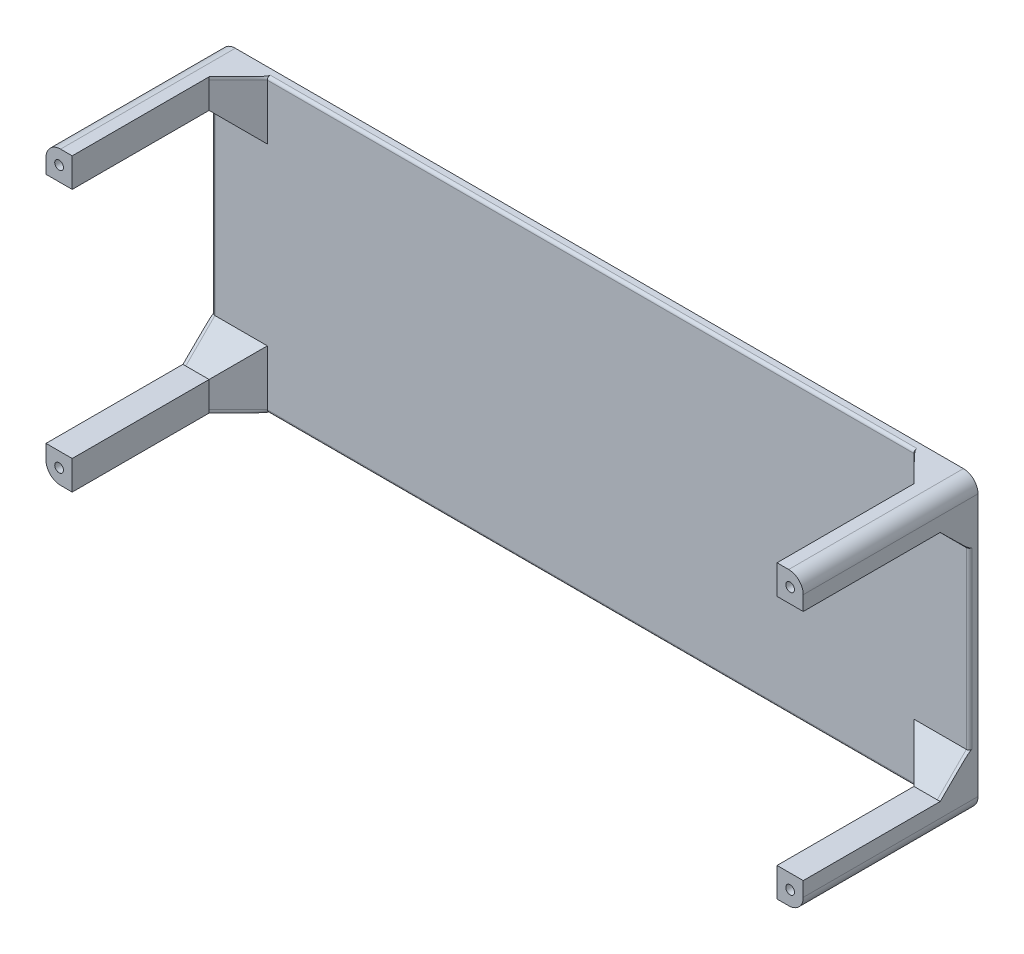
from build123d import *

# Parameters (mm, degrees)
SKETCH_1_W          = 260
SKETCH_1_H          = 100
EXTRUDE_1_DEPTH     = 3
SKETCH_2_W          = 9
SKETCH_2_H          = 10
EXTRUDE_2_DEPTH     = 60
FILLET_3_R          = 5
FILLET_4_R          = 1
SKETCH_3_R          = 1.5
CUT_EXTRUDE_1_DEPTH = 10
CHAMFER_1_SIZE      = 10


with BuildPart() as part:
    # 草图1 → 凸台-拉伸1 (new body)
    with BuildSketch(Plane.XY):
        Rectangle(SKETCH_1_W, SKETCH_1_H)
    extrude(amount=EXTRUDE_1_DEPTH)

    # 草图2 → 凸台-拉伸2 (add)
    with BuildSketch(Plane(origin=(0, 0, 0), x_dir=(-1, 0, 0), z_dir=(0, 0, -1))):
        with Locations((125.5, 45)):
            Rectangle(SKETCH_2_W, SKETCH_2_H)
        with Locations((125.5, -45)):
            Rectangle(SKETCH_2_W, SKETCH_2_H)
        with Locations((-125.5, -45)):
            Rectangle(SKETCH_2_W, SKETCH_2_H)
        with Locations((-125.5, 45)):
            Rectangle(SKETCH_2_W, SKETCH_2_H)
    extrude(amount=-EXTRUDE_2_DEPTH)

    # 圆角3
    fillet_3_edges = [part.edges().sort_by_distance(p)[0] for p in [
        (130, -50, 30),
        (-130, -50, 30),
        (-130, 50, 30),
        (130, 50, 30),
    ]]
    fillet(fillet_3_edges, radius=FILLET_3_R)

    # 圆角4
    fillet_4_edges = [part.edges().sort_by_distance(p)[0] for p in [
        (0, -50, 3),
        (-130, 0, 3),
        (130, 0, 3),
        (0, 50, 3),
    ]]
    fillet(fillet_4_edges, radius=FILLET_4_R)

    # 草图3 → 切除-拉伸1 (cut)
    with BuildSketch(Plane.XY.offset(60)):
        with Locations((125.5, -45)):
            Circle(SKETCH_3_R)
        with Locations((125.5, 45)):
            Circle(SKETCH_3_R)
        with Locations((-125.5, -45)):
            Circle(SKETCH_3_R)
        with Locations((-125.5, 45)):
            Circle(SKETCH_3_R)
    extrude(amount=-CUT_EXTRUDE_1_DEPTH, mode=Mode.SUBTRACT)

    # 倒角1
    # the kernel refuses this chamfer: 10 mm, written as the material it adds along each edge
    with BuildSketch(Plane(origin=(121, 40, 3), x_dir=(0, -1, 0), z_dir=(1, 0, 0))) as chamfer_1_piece_1:
        Polygon((CHAMFER_1_SIZE, 0), (0, -CHAMFER_1_SIZE), (0, 0), align=None)
    extrude(amount=8)
    with BuildSketch(Plane(origin=(-121, 49, 3), x_dir=(1, 0, 0), z_dir=(0, -1, 0))) as chamfer_1_piece_2:
        Polygon((CHAMFER_1_SIZE, 0), (0, CHAMFER_1_SIZE), (0, 0), align=None)
    extrude(amount=9)
    with BuildSketch(Plane(origin=(-129, -40, 3), x_dir=(0, 1, 0), z_dir=(1, 0, 0)), Plane(origin=(-121, 40, 3), x_dir=(0, -1, 0), z_dir=(-1, 0, 0)), Plane(origin=(121, -40, 3), x_dir=(0, 1, 0), z_dir=(1, 0, 0))) as chamfer_1_piece_3:
        Polygon((CHAMFER_1_SIZE, 0), (0, CHAMFER_1_SIZE), (0, 0), align=None)
    extrude(amount=8)
    with BuildSketch(Plane(origin=(121, -49, 3), x_dir=(0, 0, 1), z_dir=(0, 1, 0)), Plane(origin=(-121, -40, 3), x_dir=(0, 0, 1), z_dir=(0, -1, 0)), Plane(origin=(121, 49, 3), x_dir=(-1, 0, 0), z_dir=(0, -1, 0))) as chamfer_1_piece_4:
        Polygon((CHAMFER_1_SIZE, 0), (0, -CHAMFER_1_SIZE), (0, 0), align=None)
    extrude(amount=9)
    with BuildSketch(Plane(origin=(-121, 49, 2), x_dir=(0, 0, 1), z_dir=(0, -1, 0))) as chamfer_1_piece_5_section:
        Polygon((1 + CHAMFER_1_SIZE, 0), (1, -CHAMFER_1_SIZE), (1, 0), align=None)
    chamfer_1_piece_5 = revolve(axis=Axis((-121, 49, 2), (-1, 0, 0)), revolution_arc=359.64, mode=Mode.PRIVATE)
    chamfer_1_piece_5 = split(chamfer_1_piece_5, bisect_by=Plane(origin=(-121, 49, 0), z_dir=(0, 0, 1)), keep=Keep.TOP, mode=Mode.PRIVATE)
    chamfer_1_piece_5 = split(chamfer_1_piece_5, bisect_by=Plane(origin=(-121, 50, 2), z_dir=(0, -1, 0)), keep=Keep.TOP, mode=Mode.PRIVATE)
    add(chamfer_1_piece_5)
    with BuildSketch(Plane(origin=(121, 49, 2), x_dir=(0, 0, 1), z_dir=(0, -1, 0))) as chamfer_1_piece_6_section:
        Polygon((1, CHAMFER_1_SIZE), (1 + CHAMFER_1_SIZE, 0), (1, 0), align=None)
    chamfer_1_piece_6 = revolve(axis=Axis((121, 49, 2), (-1, 0, 0)), revolution_arc=359.64, mode=Mode.PRIVATE)
    chamfer_1_piece_6 = split(chamfer_1_piece_6, bisect_by=Plane(origin=(121, 49, 0), z_dir=(0, 0, 1)), keep=Keep.TOP, mode=Mode.PRIVATE)
    chamfer_1_piece_6 = split(chamfer_1_piece_6, bisect_by=Plane(origin=(121, 50, 2), z_dir=(0, -1, 0)), keep=Keep.TOP, mode=Mode.PRIVATE)
    add(chamfer_1_piece_6)
    with BuildSketch(Plane(origin=(-129, -40, 2), x_dir=(0, 0, 1), z_dir=(1, 0, 0))) as chamfer_1_piece_7_section:
        Polygon((1 + CHAMFER_1_SIZE, 0), (1, -CHAMFER_1_SIZE), (1, 0), align=None)
    chamfer_1_piece_7 = revolve(axis=Axis((-129, -40, 2), (0, -1, 0)), revolution_arc=359.64, mode=Mode.PRIVATE)
    chamfer_1_piece_7 = split(chamfer_1_piece_7, bisect_by=Plane(origin=(-129, -40, 0), z_dir=(0, 0, 1)), keep=Keep.TOP, mode=Mode.PRIVATE)
    chamfer_1_piece_7 = split(chamfer_1_piece_7, bisect_by=Plane(origin=(-130, -40, 2), z_dir=(1, 0, 0)), keep=Keep.TOP, mode=Mode.PRIVATE)
    add(chamfer_1_piece_7)
    with BuildSketch(Plane(origin=(-129, 40, 2), x_dir=(0, 0, 1), z_dir=(1, 0, 0))) as chamfer_1_piece_8_section:
        Polygon((1, CHAMFER_1_SIZE), (1 + CHAMFER_1_SIZE, 0), (1, 0), align=None)
    chamfer_1_piece_8 = revolve(axis=Axis((-129, 40, 2), (0, -1, 0)), revolution_arc=359.64, mode=Mode.PRIVATE)
    chamfer_1_piece_8 = split(chamfer_1_piece_8, bisect_by=Plane(origin=(-129, 40, 0), z_dir=(0, 0, 1)), keep=Keep.TOP, mode=Mode.PRIVATE)
    chamfer_1_piece_8 = split(chamfer_1_piece_8, bisect_by=Plane(origin=(-130, 40, 2), z_dir=(1, 0, 0)), keep=Keep.TOP, mode=Mode.PRIVATE)
    add(chamfer_1_piece_8)
    with BuildSketch(Plane(origin=(129, 40, 2), x_dir=(0, 0, 1), z_dir=(-1, 0, 0))) as chamfer_1_piece_9_section:
        Polygon((1, -CHAMFER_1_SIZE), (1 + CHAMFER_1_SIZE, 0), (1, 0), align=None)
    chamfer_1_piece_9 = revolve(axis=Axis((129, 40, 2), (0, 1, 0)), revolution_arc=359.64, mode=Mode.PRIVATE)
    chamfer_1_piece_9 = split(chamfer_1_piece_9, bisect_by=Plane(origin=(129, 40, 0), z_dir=(0, 0, 1)), keep=Keep.TOP, mode=Mode.PRIVATE)
    chamfer_1_piece_9 = split(chamfer_1_piece_9, bisect_by=Plane(origin=(130, 40, 2), z_dir=(-1, 0, 0)), keep=Keep.TOP, mode=Mode.PRIVATE)
    add(chamfer_1_piece_9)
    with BuildSketch(Plane(origin=(129, -40, 2), x_dir=(0, 0, 1), z_dir=(-1, 0, 0))) as chamfer_1_piece_10_section:
        Polygon((1 + CHAMFER_1_SIZE, 0), (1, CHAMFER_1_SIZE), (1, 0), align=None)
    chamfer_1_piece_10 = revolve(axis=Axis((129, -40, 2), (0, 1, 0)), revolution_arc=359.64, mode=Mode.PRIVATE)
    chamfer_1_piece_10 = split(chamfer_1_piece_10, bisect_by=Plane(origin=(129, -40, 0), z_dir=(0, 0, 1)), keep=Keep.TOP, mode=Mode.PRIVATE)
    chamfer_1_piece_10 = split(chamfer_1_piece_10, bisect_by=Plane(origin=(130, -40, 2), z_dir=(-1, 0, 0)), keep=Keep.TOP, mode=Mode.PRIVATE)
    add(chamfer_1_piece_10)
    with BuildSketch(Plane(origin=(121, -49, 2), x_dir=(0, 0.006283143965553963, 0.9999802608561372), z_dir=(0, -0.9999802608561372, 0.006283143965553963))) as chamfer_1_piece_11_section:
        Polygon((1, CHAMFER_1_SIZE), (1 + CHAMFER_1_SIZE, 0), (1, 0), align=None)
    chamfer_1_piece_11 = revolve(axis=Axis((121, -49, 2), (-1, 0, 0)), revolution_arc=359.64, mode=Mode.PRIVATE)
    chamfer_1_piece_11 = split(chamfer_1_piece_11, bisect_by=Plane(origin=(121, -50, 2), z_dir=(0, 1, 0)), keep=Keep.TOP, mode=Mode.PRIVATE)
    chamfer_1_piece_11 = split(chamfer_1_piece_11, bisect_by=Plane(origin=(121, -49, 0), z_dir=(0, 0, 1)), keep=Keep.TOP, mode=Mode.PRIVATE)
    add(chamfer_1_piece_11)
    with BuildSketch(Plane(origin=(-121, -49, 2), x_dir=(0, 0.006283143965553963, 0.9999802608561372), z_dir=(0, -0.9999802608561372, 0.006283143965553963))) as chamfer_1_piece_12_section:
        Polygon((1 + CHAMFER_1_SIZE, 0), (1, -CHAMFER_1_SIZE), (1, 0), align=None)
    chamfer_1_piece_12 = revolve(axis=Axis((-121, -49, 2), (-1, 0, 0)), revolution_arc=359.64, mode=Mode.PRIVATE)
    chamfer_1_piece_12 = split(chamfer_1_piece_12, bisect_by=Plane(origin=(-121, -50, 2), z_dir=(0, 1, 0)), keep=Keep.TOP, mode=Mode.PRIVATE)
    chamfer_1_piece_12 = split(chamfer_1_piece_12, bisect_by=Plane(origin=(-121, -49, 0), z_dir=(0, 0, 1)), keep=Keep.TOP, mode=Mode.PRIVATE)
    add(chamfer_1_piece_12)
    with BuildSketch(Plane(origin=(95.28317012, 40, 3), x_dir=(0, -1, 0), z_dir=(1, 0, 0))) as chamfer_1_piece_13a_section:
        Polygon((CHAMFER_1_SIZE, 0), (0, -CHAMFER_1_SIZE), (0, 0), align=None)
    chamfer_1_piece_13a = extrude(amount=33.71682988, mode=Mode.PRIVATE)
    chamfer_1_piece_13a = split(chamfer_1_piece_13a, bisect_by=Plane(origin=(121, 40, 3), z_dir=(-1, 0, 0)), keep=Keep.TOP, mode=Mode.PRIVATE)
    with BuildSketch(Plane(origin=(121, 49, 3), x_dir=(-1, 0, 0), z_dir=(0, -1, 0))) as chamfer_1_piece_13b_section:
        Polygon((CHAMFER_1_SIZE, 0), (0, -CHAMFER_1_SIZE), (0, 0), align=None)
    chamfer_1_piece_13b = extrude(amount=34.71682988, mode=Mode.PRIVATE)
    chamfer_1_piece_13b = split(chamfer_1_piece_13b, bisect_by=Plane(origin=(121, 40, 3), z_dir=(0, -1, 0)), keep=Keep.TOP, mode=Mode.PRIVATE)
    chamfer_1_piece_13 = chamfer_1_piece_13a & chamfer_1_piece_13b
    add(chamfer_1_piece_13)
    with BuildSketch(Plane(origin=(-95.28317012, 40, 3), x_dir=(0, -1, 0), z_dir=(-1, 0, 0))) as chamfer_1_piece_14a_section:
        Polygon((CHAMFER_1_SIZE, 0), (0, CHAMFER_1_SIZE), (0, 0), align=None)
    chamfer_1_piece_14a = extrude(amount=33.71682988, mode=Mode.PRIVATE)
    chamfer_1_piece_14a = split(chamfer_1_piece_14a, bisect_by=Plane(origin=(-121, 40, 3), z_dir=(1, 0, 0)), keep=Keep.TOP, mode=Mode.PRIVATE)
    with BuildSketch(Plane(origin=(-121, 49, 3), x_dir=(1, 0, 0), z_dir=(0, -1, 0))) as chamfer_1_piece_14b_section:
        Polygon((CHAMFER_1_SIZE, 0), (0, CHAMFER_1_SIZE), (0, 0), align=None)
    chamfer_1_piece_14b = extrude(amount=34.71682988, mode=Mode.PRIVATE)
    chamfer_1_piece_14b = split(chamfer_1_piece_14b, bisect_by=Plane(origin=(-121, 40, 3), z_dir=(0, -1, 0)), keep=Keep.TOP, mode=Mode.PRIVATE)
    chamfer_1_piece_14 = chamfer_1_piece_14a & chamfer_1_piece_14b
    add(chamfer_1_piece_14)
    with BuildSketch(Plane(origin=(-121, -14.28317012, 3), x_dir=(0, 0, 1), z_dir=(0, -1, 0))) as chamfer_1_piece_15a_section:
        Polygon((CHAMFER_1_SIZE, 0), (0, -CHAMFER_1_SIZE), (0, 0), align=None)
    chamfer_1_piece_15a = extrude(amount=34.71682988, mode=Mode.PRIVATE)
    chamfer_1_piece_15a = split(chamfer_1_piece_15a, bisect_by=Plane(origin=(-121, -40, 3), z_dir=(0, 1, 0)), keep=Keep.TOP, mode=Mode.PRIVATE)
    with BuildSketch(Plane(origin=(-129, -40, 3), x_dir=(0, 1, 0), z_dir=(1, 0, 0))) as chamfer_1_piece_15b_section:
        Polygon((CHAMFER_1_SIZE, 0), (0, CHAMFER_1_SIZE), (0, 0), align=None)
    chamfer_1_piece_15b = extrude(amount=33.71682988, mode=Mode.PRIVATE)
    chamfer_1_piece_15b = split(chamfer_1_piece_15b, bisect_by=Plane(origin=(-121, -40, 3), z_dir=(1, 0, 0)), keep=Keep.TOP, mode=Mode.PRIVATE)
    chamfer_1_piece_15 = chamfer_1_piece_15a & chamfer_1_piece_15b
    add(chamfer_1_piece_15)
    with BuildSketch(Plane(origin=(121, -49, 3), x_dir=(0, 0, 1), z_dir=(0, 1, 0))) as chamfer_1_piece_16a_section:
        Polygon((CHAMFER_1_SIZE, 0), (0, -CHAMFER_1_SIZE), (0, 0), align=None)
    chamfer_1_piece_16a = extrude(amount=34.71682988, mode=Mode.PRIVATE)
    chamfer_1_piece_16a = split(chamfer_1_piece_16a, bisect_by=Plane(origin=(121, -40, 3), z_dir=(0, 1, 0)), keep=Keep.TOP, mode=Mode.PRIVATE)
    with BuildSketch(Plane(origin=(95.28317012, -40, 3), x_dir=(0, 1, 0), z_dir=(1, 0, 0))) as chamfer_1_piece_16b_section:
        Polygon((CHAMFER_1_SIZE, 0), (0, CHAMFER_1_SIZE), (0, 0), align=None)
    chamfer_1_piece_16b = extrude(amount=33.71682988, mode=Mode.PRIVATE)
    chamfer_1_piece_16b = split(chamfer_1_piece_16b, bisect_by=Plane(origin=(121, -40, 3), z_dir=(-1, 0, 0)), keep=Keep.TOP, mode=Mode.PRIVATE)
    chamfer_1_piece_16 = chamfer_1_piece_16a & chamfer_1_piece_16b
    add(chamfer_1_piece_16)


solid = part.part
